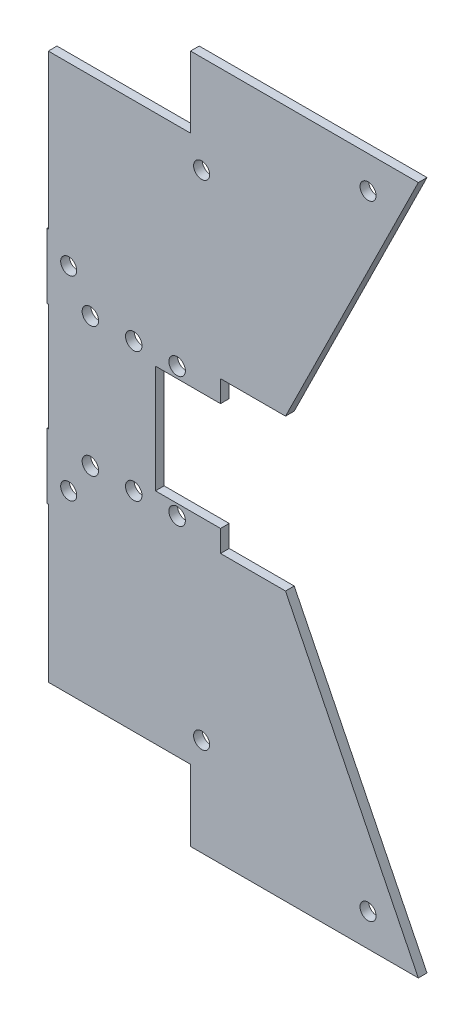
from build123d import *

# Parameters (mm, degrees)
SKETCH1_R           = 2.3495
BOSS_EXTRUDE1_DEPTH = 2.54
SKETCH2_R           = 2.413
CUT_EXTRUDE1_DEPTH  = 217.884748371
SKETCH3_W           = 19.05
SKETCH3_H           = 31.623
CUT_EXTRUDE2_DEPTH  = 217.884748371


with BuildPart() as part:
    # Sketch1 → Boss-Extrude1 (new body)
    with BuildSketch(Plane.XY):
        Polygon((-2.930050059, -104.509781075), (-3.314938219, -104.509781075), (-3.314938219, -110.859781075), (-3.314938219, -123.559781075), (-2.930050059, -123.559781075), (-2.930050059, -168.708281075), (38.709428475, -168.708281075), (38.709428475, -189.536281075), (105.397061781, -189.536281075), (66.517436481, -110.859781075), (47.485061781, -110.859781075), (47.485061781, -104.509781075), (47.485061781, -72.886781075), (47.485061781, -66.536781075), (66.517436481, -66.536781075), (105.397061781, 12.139718925), (38.709428475, 12.139718925), (38.709428475, -8.688281075), (-2.930050059, -8.688281075), (-2.930050059, -53.836781075), (-3.314938219, -53.836781075), (-3.314938219, -66.536781075), (-3.314938219, -72.886781075), (-2.930050059, -72.886781075), align=None)
        with Locations((90.673911143, 2.614718925)):
            Circle(SKETCH1_R, mode=Mode.SUBTRACT)
        with Locations((41.95655448, -16.435281075)):
            Circle(SKETCH1_R, mode=Mode.SUBTRACT)
        with Locations((3.035061781, -60.186781075)):
            Circle(SKETCH1_R, mode=Mode.SUBTRACT)
        with Locations((3.035061781, -117.209781075)):
            Circle(SKETCH1_R, mode=Mode.SUBTRACT)
        with Locations((41.95655448, -160.961281075)):
            Circle(SKETCH1_R, mode=Mode.SUBTRACT)
        with Locations((90.673911143, -180.011281075)):
            Circle(SKETCH1_R, mode=Mode.SUBTRACT)
    extrude(amount=BOSS_EXTRUDE1_DEPTH)

    # Sketch2 → Cut-Extrude1 (cut, through all)
    with BuildSketch(Plane.XY.offset(2.54)):
        with Locations((9.385061781, -69.711781075)):
            Circle(SKETCH2_R)
        with Locations((22.085061781, -69.711781075)):
            Circle(SKETCH2_R)
        with Locations((34.785061781, -69.711781075)):
            Circle(SKETCH2_R)
        with Locations((34.785061781, -107.684781075)):
            Circle(SKETCH2_R)
        with Locations((22.085061781, -107.684781075)):
            Circle(SKETCH2_R)
        with Locations((9.385061781, -107.684781075)):
            Circle(SKETCH2_R)
    extrude(amount=-CUT_EXTRUDE1_DEPTH, mode=Mode.SUBTRACT)

    # Sketch3 → Cut-Extrude2 (cut, through all)
    with BuildSketch(Plane.XY.offset(2.54)):
        with Locations((37.960061781, -88.698281075)):
            Rectangle(SKETCH3_W, SKETCH3_H)
    extrude(amount=-CUT_EXTRUDE2_DEPTH, mode=Mode.SUBTRACT)


solid = part.part
